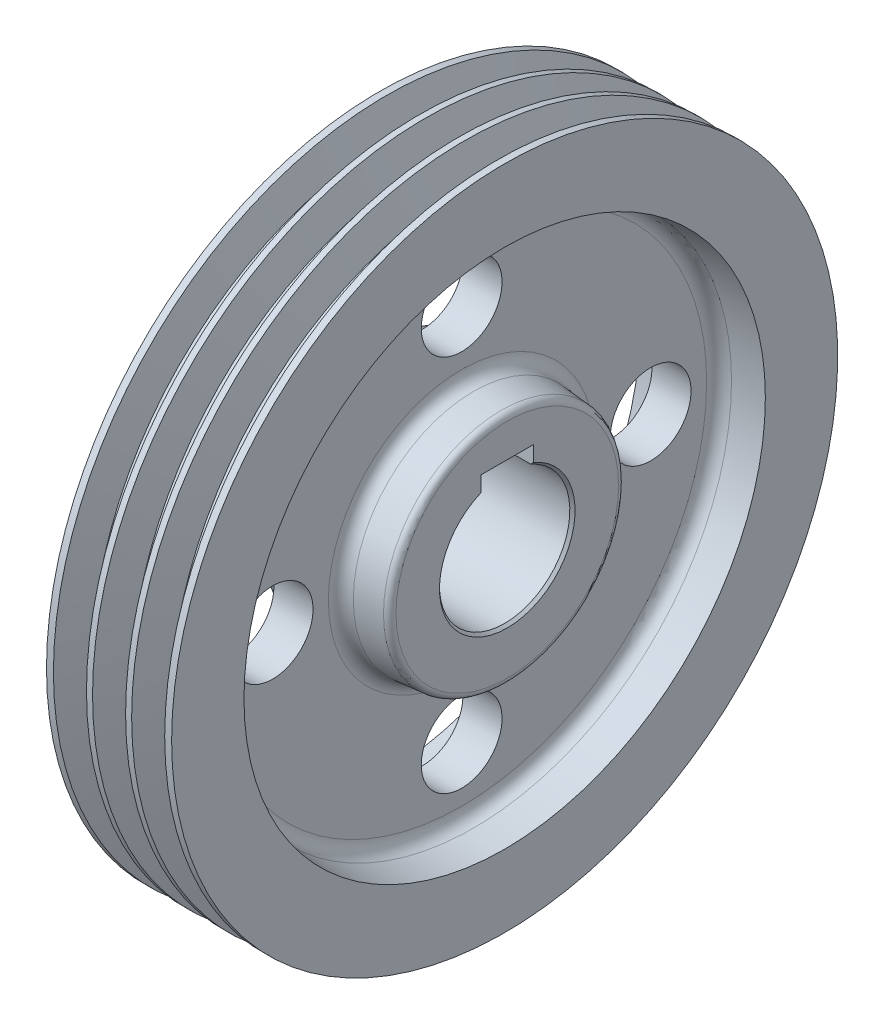
from build123d import *

# Parameters (mm, degrees)
PATTERN_LINEAR_1000_COUNT   = 3
PATTERN_LINEAR_1000_PITCH   = 15
CHAMFER_1_SIZE              = 1
SKETCH_4_W                  = 20
SKETCH_4_H                  = 6.987121525
CUT_EXTRUDE_1_DEPTH         = 188.456995068
FILLET_1_R                  = 5
FILLET_2_R                  = 2.5
SKETCH_5_R                  = 15.5
CUT_EXTRUDE_2_DEPTH         = 188.192748257
PATTERN_CIRCULAR_1827_COUNT = 4


with BuildPart() as part:
    # 草图1 → 旋转1 (revolve)
    with BuildSketch(Plane.XY):
        Polygon((-1, 25), (-1, 45), (16.5, 46.531051612), (16.5, 98.556437052), (0, 100), (0, 127.75), (48, 127.75), (48, 100), (31.5, 98.556437052), (31.5, 46.531051612), (49, 45), (49, 25), align=None)
    revolve(axis=Axis((0, 0, 0), (1, 0, 0)))

    # 草图2 → 切除-旋转1 (revolve, cut)
    with BuildSketch(Plane.XY):
        Polygon((11.840143071, 116.3), (15.340759374, 127.75), (2.659240626, 127.75), (6.159856929, 116.3), align=None)
    cut_revolve_1 = revolve(axis=Axis((0, 0, 0), (1, 0, 0)), mode=Mode.SUBTRACT)

    # Pattern Linear 1000: 切除-旋转1 ×3
    with Locations(*[(i * PATTERN_LINEAR_1000_PITCH, 0, 0) for i in range(1, PATTERN_LINEAR_1000_COUNT)]):
        add(cut_revolve_1, mode=Mode.SUBTRACT)

    # 倒角1
    chamfer_1_edges = [part.edges().sort_by_distance(p)[0] for p in [
        (-1, -25, 0),
        (49, -25, 0),
    ]]
    chamfer(chamfer_1_edges, length=CHAMFER_1_SIZE)

    # 草图4 → 切除-拉伸1 (cut, through all)
    with BuildSketch(Plane.ZY.offset(1)):
        with Locations((0, 26.406439238)):
            Rectangle(SKETCH_4_W, SKETCH_4_H)
    extrude(amount=-CUT_EXTRUDE_1_DEPTH, mode=Mode.SUBTRACT)

    # 圆角1
    fillet_1_edges = [part.edges().sort_by_distance(p)[0] for p in [
        (31.5, -98.556437052, 0),
        (16.5, -46.531051612, 0),
        (16.5, -98.556437052, 0),
        (31.5, -46.531051612, 0),
    ]]
    fillet(fillet_1_edges, radius=FILLET_1_R)

    # 圆角2
    fillet_2_edges = [part.edges().sort_by_distance(p)[0] for p in [
        (49, -45, 0),
        (-1, -45, 0),
    ]]
    fillet(fillet_2_edges, radius=FILLET_2_R)

    # 草图5 → 切除-拉伸2 (cut, through all)
    with BuildSketch(Plane(origin=(0, 0, 0), x_dir=(0, 0, -1), z_dir=(1, 0, 0))):
        with Locations((0, 72.5)):
            Circle(SKETCH_5_R)
    cut_extrude_2 = extrude(amount=CUT_EXTRUDE_2_DEPTH, mode=Mode.SUBTRACT)

    # Pattern Circular 1827: 切除-拉伸2 ×4 about axis
    pattern_circular_1827_axis = Axis((0, 0, 0), (-1, 0, 0))
    for i in range(1, PATTERN_CIRCULAR_1827_COUNT):
        add(cut_extrude_2.rotate(pattern_circular_1827_axis, i * 360 / PATTERN_CIRCULAR_1827_COUNT), mode=Mode.SUBTRACT)


solid = part.part
